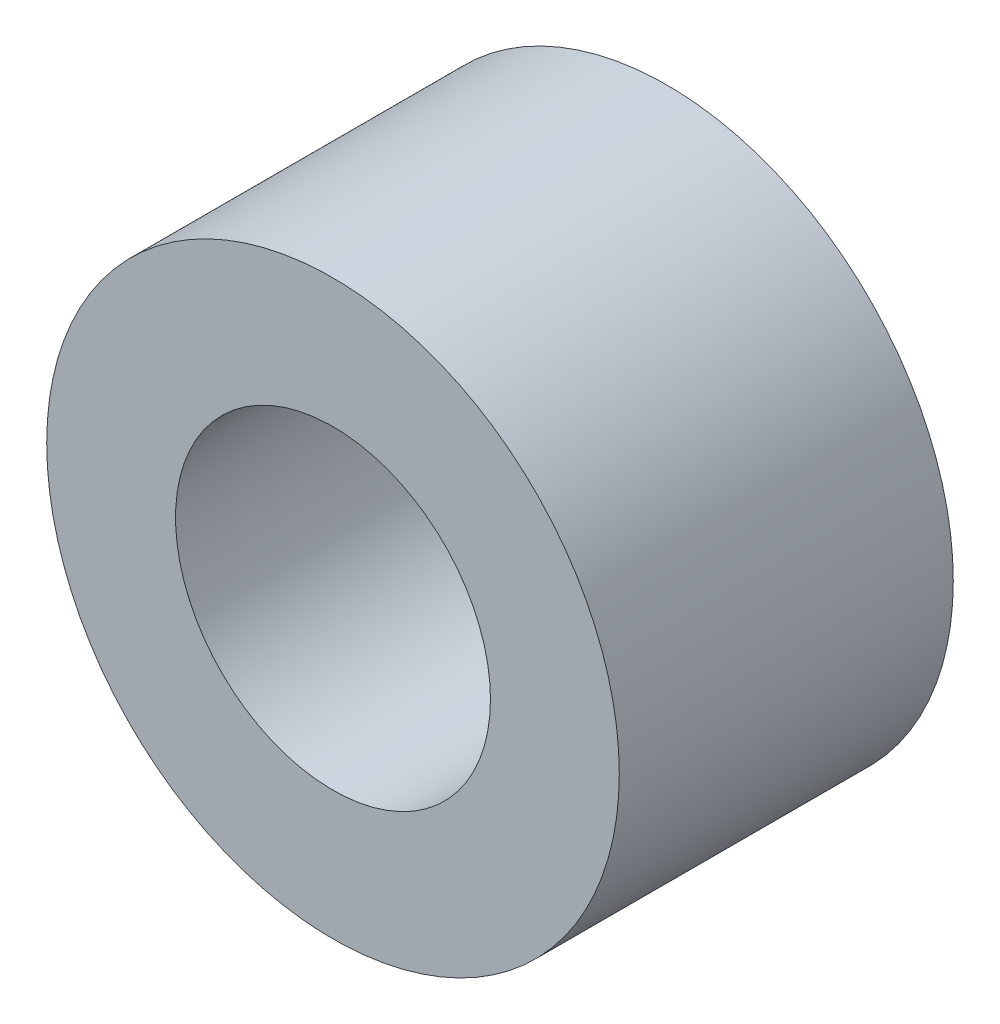
from build123d import *

# Parameters (mm, degrees)
SKETCH1_R           = 9.525
SKETCH1_R_2         = 5.23875
BOSS_EXTRUDE1_DEPTH = 5.55625


with BuildPart() as part:
    # Sketch1 → Boss-Extrude1 (new, symmetric)
    with BuildSketch(Plane.XY):
        Circle(SKETCH1_R)
        Circle(SKETCH1_R_2, mode=Mode.SUBTRACT)
    extrude(amount=BOSS_EXTRUDE1_DEPTH, both=True)


solid = part.part
